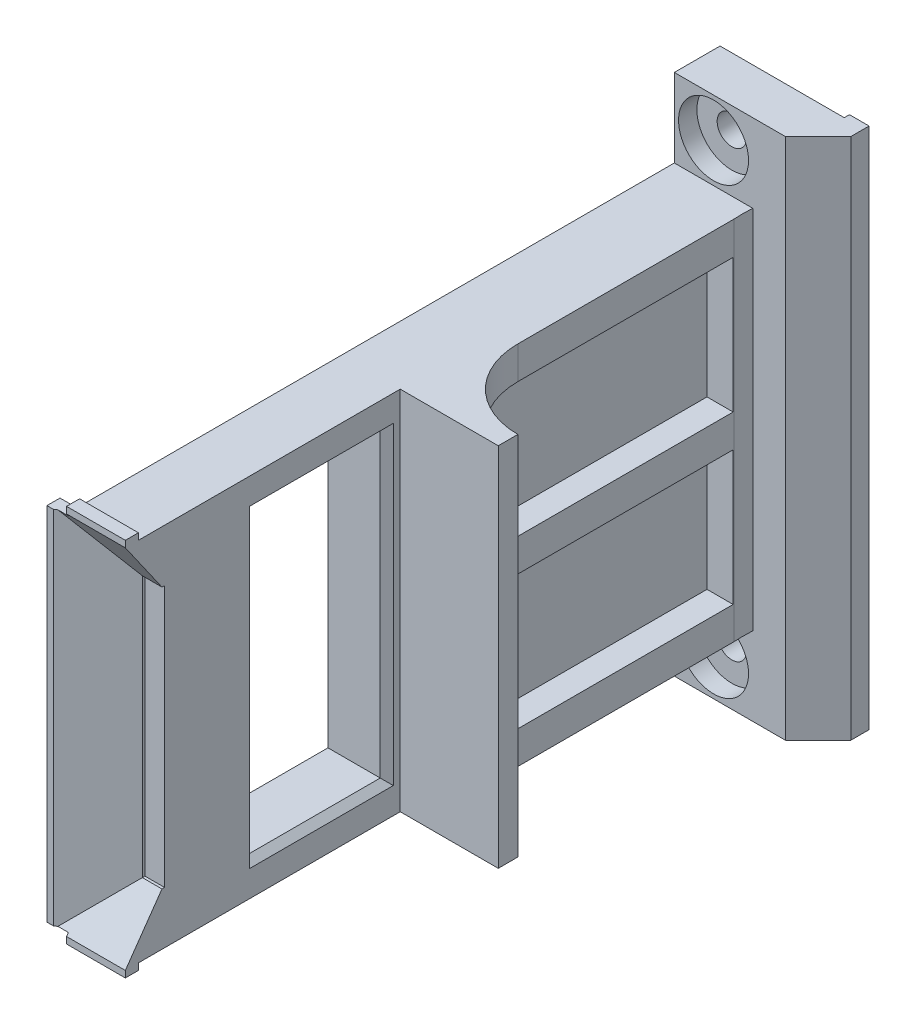
from build123d import *
from OCP.BRepFilletAPI import BRepFilletAPI_MakeChamfer

# Parameters (mm, degrees)
SKETCH_1_W              = 12
SKETCH_1_H              = 46
EXTRUDE_1_DEPTH         = 57
SKETCH_2_W              = 20
SKETCH_2_H              = 46.080872769
CUT_EXTRUDE_1_DEPTH     = 60
SKETCH_3_W              = 12
SKETCH_3_H              = 57
EXTRUDE_2_DEPTH         = 5
SKETCH_4_W              = 12
SKETCH_4_H              = 56
EXTRUDE_3_DEPTH         = 40
SKETCH_5_W              = 12
SKETCH_5_H              = 7
EXTRUDE_4_DEPTH         = 12
M4_A_1_D                = 4.5
M4_A_1_CBORE_D          = 10.705
M4_A_1_CBORE_DEPTH      = 2.8
SKETCH_8_W              = 15
SKETCH_8_H              = 56
EXTRUDE_5_DEPTH         = 3
SKETCH_9_W              = 6
SKETCH_9_H              = 40
CUT_EXTRUDE_2_DEPTH     = 6
CHAMFER_1_SIZE          = 8
CHAMFER_1_SIZE_2        = 5.601660306
SKETCH_10_W             = 6
SKETCH_10_H             = 39.2
EXTRUDE_6_DEPTH         = 9
CUT_EXTRUDE_START       = -4
CUT_EXTRUDE_3_OUTLINE_W = 3
CUT_EXTRUDE_3_OUTLINE_H = 0.4
CUT_EXTRUDE_3_DEPTH     = 5
CHAMFER_2_SIZE          = 1
CHAMFER_3_SIZE          = 2
CHAMFER_3_SIZE2         = 1.400415076
SKETCH_12_W             = 45
SKETCH_12_H             = 20.5
CUT_EXTRUDE_4_DEPTH     = 4
SKETCH_14_W             = 7
SKETCH_14_H             = 80
EXTRUDE_7_DEPTH         = 10
CUT_EXTRUDE_5_DEPTH     = 102.271911209
SKETCH_16_W             = 3
SKETCH_16_H             = 56
EXTRUDE_8_DEPTH         = 12
CHAMFER_5_SIZE          = 5
CUT_EXTRUDE_START_2     = -42.060641
SKETCH_17_W             = 3
SKETCH_17_H             = 56
CUT_EXTRUDE_6_DEPTH     = 42.060641
CHAMFER_4_SIZE          = 1
FILLET_1_R              = 12
SKETCH_22_W             = 3
SKETCH_22_H             = 80
EXTRUDE_11_DEPTH        = 0.8
SKETCH_24_W             = 9
SKETCH_24_H             = 2
EXTRUDE_13_DEPTH        = 1


with BuildPart() as part:
    # 스케치1 → 보스-돌출1 (new body)
    with BuildSketch(Plane.XY):
        Rectangle(SKETCH_1_W, SKETCH_1_H)
    extrude(amount=EXTRUDE_1_DEPTH)

    # 스케치2 → 컷-돌출1 (cut)
    with BuildSketch(Plane(origin=(6, 0, 0), x_dir=(0, 0, -1), z_dir=(1, 0, 0))):
        with Locations((-30, 0.040436385)):
            Rectangle(SKETCH_2_W, SKETCH_2_H)
    extrude(amount=-CUT_EXTRUDE_1_DEPTH, mode=Mode.SUBTRACT)


with BuildPart() as cut_extrude_1_piece_1:
    # of the separate pieces the step leaves, piece 1, a body of its own (cut_extrude_1_pieces)
    add(part.part.solids().sort_by_distance((-6, 23, 0))[0])



with BuildPart() as cut_extrude_1_piece_2:
    # of the separate pieces the step leaves, piece 2, a body of its own (cut_extrude_1_pieces)
    add(part.part.solids().sort_by_distance((6, 23, 40))[0])


with BuildPart() as cut_extrude_1_piece_1_1:
    add(cut_extrude_1_piece_1.part)

    add(cut_extrude_1_piece_2.part)  # 보스-돌출2 merges 컷-돌출1 piece 2
    # 스케치3 → 보스-돌출2 (add)
    with BuildSketch(Plane.XZ.offset(23)):
        with Locations((0, 28.5)):
            Rectangle(SKETCH_3_W, SKETCH_3_H)
    extrude_2 = extrude(amount=EXTRUDE_2_DEPTH)

    # 대칭 복사1: 보스-돌출2 across plane
    add(extrude_2.mirror(Plane.ZX))

    # 스케치4 → 보스-돌출3 (add)
    with BuildSketch(Plane(origin=(0, 0, 0), x_dir=(-1, 0, 0), z_dir=(0, 0, -1))):
        Rectangle(SKETCH_4_W, SKETCH_4_H)
    extrude(amount=EXTRUDE_3_DEPTH)

    # 스케치5 → 보스-돌출4 (add)
    with BuildSketch(Plane.XZ.offset(28)):
        with Locations((0, -36.5)):
            Rectangle(SKETCH_5_W, SKETCH_5_H)
    extrude_4 = extrude(amount=EXTRUDE_4_DEPTH)

    # 대칭 복사2: 보스-돌출4 across plane
    add(extrude_4.mirror(Plane.ZX))

    # M4 육각 머리 볼트용 카운터보어 (A 등급)1 (through all)
    with Locations(Plane.XY.offset(-33)):
        with Locations((0, -34), (0, 34)):
            CounterBoreHole(M4_A_1_D / 2, M4_A_1_CBORE_D / 2, M4_A_1_CBORE_DEPTH)

    # 스케치8 → 보스-돌출5 (add)
    with BuildSketch(Plane.XY.offset(57)):
        with Locations((-1.5, 0)):
            Rectangle(SKETCH_8_W, SKETCH_8_H)
    extrude(amount=EXTRUDE_5_DEPTH)

    # 스케치9 → 컷-돌출2 (cut)
    with BuildSketch(Plane.XY.offset(60)):
        with Locations((3, 0)):
            Rectangle(SKETCH_9_W, SKETCH_9_H)
    extrude(amount=-CUT_EXTRUDE_2_DEPTH, mode=Mode.SUBTRACT)

    # 모따기1
    chamfer_1_edges_1 = [cut_extrude_1_piece_1_1.edges().sort_by_distance(p)[0] for p in [
        (0, 0, 60),
    ]]
    chamfer_1_side_1 = [cut_extrude_1_piece_1_1.faces().sort_by_distance(p)[0] for p in [
        (-0.112033206, 0, 60),
    ]]
    chamfer_1_edges_2 = [cut_extrude_1_piece_1_1.edges().sort_by_distance(p)[0] for p in [
        (3, 20, 60),
    ]]
    chamfer_1_side_2 = [cut_extrude_1_piece_1_1.faces().sort_by_distance(p)[0] for p in [
        (3, 20.112033206, 60),
    ]]
    chamfer_1_edges_3 = [cut_extrude_1_piece_1_1.edges().sort_by_distance(p)[0] for p in [
        (3, -20, 60),
    ]]
    chamfer_1_side_3 = [cut_extrude_1_piece_1_1.faces().sort_by_distance(p)[0] for p in [
        (3, -20.112033206, 60),
    ]]
    chamfer_1 = BRepFilletAPI_MakeChamfer(cut_extrude_1_piece_1_1.part.solid().wrapped)
    for e in chamfer_1_edges_1:
        chamfer_1.Add(CHAMFER_1_SIZE - 0.0001, CHAMFER_1_SIZE_2 - 0.0001, e.wrapped, chamfer_1_side_1[0].wrapped)
    for e in chamfer_1_edges_2:
        chamfer_1.Add(CHAMFER_1_SIZE - 0.0001, CHAMFER_1_SIZE_2 - 0.0001, e.wrapped, chamfer_1_side_2[0].wrapped)
    for e in chamfer_1_edges_3:
        chamfer_1.Add(CHAMFER_1_SIZE - 0.0001, CHAMFER_1_SIZE_2 - 0.0001, e.wrapped, chamfer_1_side_3[0].wrapped)
    add(Compound.cast(chamfer_1.Shape()), mode=Mode.REPLACE)  # a hair under: the kernel refuses the full size

    # 스케치10 → 보스-돌출6 (add)
    with BuildSketch(Plane(origin=(0, 0, -40), x_dir=(-1, 0, 0), z_dir=(0, 0, -1))):
        with Locations((-3, 0)):
            Rectangle(SKETCH_10_W, SKETCH_10_H)
    extrude(amount=EXTRUDE_6_DEPTH)

    # 컷-돌출3: read off the stored shape, not the designer's step
    # 컷-돌출3 outline → 컷-돌출3 (cut)
    with BuildSketch(Plane.XY.offset(60).offset(CUT_EXTRUDE_START)):
        with Locations((-7.5, 27.8)):
            Rectangle(CUT_EXTRUDE_3_OUTLINE_W, CUT_EXTRUDE_3_OUTLINE_H)
        with Locations((-7.5, -27.8)):
            Rectangle(CUT_EXTRUDE_3_OUTLINE_W, CUT_EXTRUDE_3_OUTLINE_H)
    extrude(amount=CUT_EXTRUDE_3_DEPTH, mode=Mode.SUBTRACT)

    # 모따기2
    chamfer_2_edges = [cut_extrude_1_piece_1_1.edges().sort_by_distance(p)[0] for p in [
        (-7.5, -27.6, 57),
        (-7.5, 27.6, 57),
    ]]
    chamfer(chamfer_2_edges, length=CHAMFER_2_SIZE)

    # 모따기3: one chamfer whose edges measure the first distance from different faces: ONE call of the kernel's chamfer builder (chamfer() names one face for all edges)
    chamfer_3_edges_1 = [cut_extrude_1_piece_1_1.edges().sort_by_distance(p)[0] for p in [
        (6, 0, -49),
    ]]
    chamfer_3_side_1 = [cut_extrude_1_piece_1_1.faces().sort_by_distance(p)[0] for p in [
        (6, 0, -1.976539193),
    ]]
    chamfer_3_edges_2 = [cut_extrude_1_piece_1_1.edges().sort_by_distance(p)[0] for p in [
        (3, -19.6, -49),
    ]]
    chamfer_3_side_2 = [cut_extrude_1_piece_1_1.faces().sort_by_distance(p)[0] for p in [
        (3, -19.6, -44.5),
    ]]
    chamfer_3_edges_3 = [cut_extrude_1_piece_1_1.edges().sort_by_distance(p)[0] for p in [
        (0, 0, -49),
    ]]
    chamfer_3_side_3 = [cut_extrude_1_piece_1_1.faces().sort_by_distance(p)[0] for p in [
        (0, 0, -44.5),
    ]]
    chamfer_3_edges_4 = [cut_extrude_1_piece_1_1.edges().sort_by_distance(p)[0] for p in [
        (3, 19.6, -49),
    ]]
    chamfer_3_side_4 = [cut_extrude_1_piece_1_1.faces().sort_by_distance(p)[0] for p in [
        (3, 19.6, -44.5),
    ]]
    chamfer_3 = BRepFilletAPI_MakeChamfer(cut_extrude_1_piece_1_1.part.solid().wrapped)
    for e in chamfer_3_edges_1:
        chamfer_3.Add(CHAMFER_3_SIZE, CHAMFER_3_SIZE2, e.wrapped, chamfer_3_side_1[0].wrapped)  # the first distance lies on this face
    for e in chamfer_3_edges_2:
        chamfer_3.Add(CHAMFER_3_SIZE, CHAMFER_3_SIZE2, e.wrapped, chamfer_3_side_2[0].wrapped)  # the first distance lies on this face
    for e in chamfer_3_edges_3:
        chamfer_3.Add(CHAMFER_3_SIZE, CHAMFER_3_SIZE2, e.wrapped, chamfer_3_side_3[0].wrapped)  # the first distance lies on this face
    for e in chamfer_3_edges_4:
        chamfer_3.Add(CHAMFER_3_SIZE, CHAMFER_3_SIZE2, e.wrapped, chamfer_3_side_4[0].wrapped)  # the first distance lies on this face
    add(Compound.cast(chamfer_3.Shape()), mode=Mode.REPLACE)

    # 스케치12 → 컷-돌출4 (cut)
    with BuildSketch(Plane.ZY.offset(6)):
        with Locations((-7.5, 12.75)):
            Rectangle(SKETCH_12_W, SKETCH_12_H)
        with Locations((-7.5, -12.75)):
            Rectangle(SKETCH_12_W, SKETCH_12_H)
    cut_extrude_4 = extrude(amount=-CUT_EXTRUDE_4_DEPTH, mode=Mode.SUBTRACT)

    # 대칭 복사3: 컷-돌출4 across plane
    add(cut_extrude_4.mirror(Plane.ZY), mode=Mode.SUBTRACT)

    # 스케치14 → 보스-돌출7 (add)
    with BuildSketch(Plane(origin=(6, 0, 0), x_dir=(0, 0, -1), z_dir=(1, 0, 0))):
        with Locations((36.5, 0)):
            Rectangle(SKETCH_14_W, SKETCH_14_H)
    extrude(amount=EXTRUDE_7_DEPTH)

    # 스케치15 → 컷-돌출5 (cut, through all)
    with BuildSketch(Plane.XZ.offset(40)):
        with BuildLine():
            Line((6, -33), (16, -33))
            Line((16, -33), (16, -28.353890031))
            add(Edge.make_bspline(
                [(6, -33), (5.579283, -24.005465365), (9.542787604, -28.181394392), (15.145388019, -28.353890031), (16, -28.353890031)],
                knots=[0, 0, 0, 0, 0.752787833, 1, 1, 1, 1], degree=3))
        make_face()
    extrude(amount=-CUT_EXTRUDE_5_DEPTH, mode=Mode.SUBTRACT)

    # 스케치16 → 보스-돌출8 (add)
    with BuildSketch(Plane(origin=(6, 0, 0), x_dir=(0, 0, -1), z_dir=(1, 0, 0))):
        with Locations((-16.43935887, 0)):
            Rectangle(SKETCH_16_W, SKETCH_16_H)
    extrude(amount=EXTRUDE_8_DEPTH)

    # 모따기5
    chamfer_5_edges = [cut_extrude_1_piece_1_1.edges().sort_by_distance(p)[0] for p in [
        (16, 0, -33),
    ]]
    chamfer(chamfer_5_edges, length=CHAMFER_5_SIZE)

    # 스케치17 → 컷-돌출6 (cut)
    with BuildSketch(Plane.XY.offset(60).offset(CUT_EXTRUDE_START_2)):
        with Locations((4.5, 0)):
            Rectangle(SKETCH_17_W, SKETCH_17_H)
    extrude(amount=CUT_EXTRUDE_6_DEPTH, mode=Mode.SUBTRACT)

    # 모따기4
    chamfer_4_edges = [cut_extrude_1_piece_1_1.edges().sort_by_distance(p)[0] for p in [
        (3, -23, 30),
        (3, 23, 30),
        (3, 0, 20),
        (3, 0, 40),
    ]]
    chamfer(chamfer_4_edges, length=CHAMFER_4_SIZE)

    # 필렛1
    fillet_1_edges = [cut_extrude_1_piece_1_1.edges().sort_by_distance(p)[0] for p in [
        (6, -25.5, 14.93935887),
        (6, 0, 14.93935887),
        (6, 25.5, 14.93935887),
    ]]
    fillet(fillet_1_edges, radius=FILLET_1_R - 0.0001)  # a hair under: the kernel refuses the full size

    # 스케치22 → 보스-돌출11 (add)
    with BuildSketch(Plane(origin=(0, 0, -40), x_dir=(-1, 0, 0), z_dir=(0, 0, -1))):
        with Locations((-14.5, 0)):
            Rectangle(SKETCH_22_W, SKETCH_22_H)
    extrude(amount=EXTRUDE_11_DEPTH)

    # 스케치24 → 보스-돌출13 (add)
    with BuildSketch(Plane(origin=(0, 28, 0), x_dir=(1, 0, 0), z_dir=(0, 1, 0))):
        with Locations((-1.5, -59)):
            Rectangle(SKETCH_24_W, SKETCH_24_H)
    extrude_13 = extrude(amount=EXTRUDE_13_DEPTH)

    # 대칭 복사4: 보스-돌출13 across plane
    add(extrude_13.mirror(Plane.ZX))


solid = cut_extrude_1_piece_1_1.part
